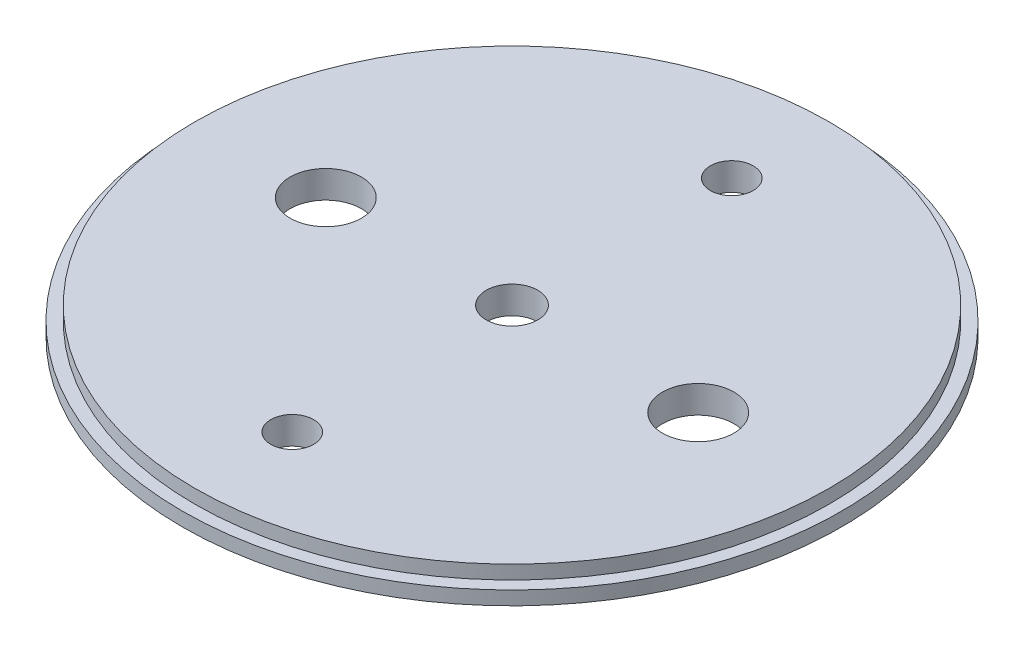
from build123d import *

# Parameters (mm, degrees)
SKETCH1_R           = 76.1746
BOSS_EXTRUDE1_DEPTH = 3.175
SKETCH1_3_R         = 73.3425
BOSS_EXTRUDE2_DEPTH = 6.35
SKETCH3_R           = 5.953125
SKETCH3_R_2         = 8.250047
SKETCH3_R_3         = 4.9609375
CUT_EXTRUDE1_DEPTH  = 108.914141197


with BuildPart() as part:
    # Sketch1 → Boss-Extrude1 (new body)
    with BuildSketch(Plane(origin=(0, 0, 0), x_dir=(1, 0, 0), z_dir=(0, 1, 0))):
        Circle(SKETCH1_R)
    extrude(amount=BOSS_EXTRUDE1_DEPTH)

    # Sketch1<3> → Boss-Extrude2 (add)
    with BuildSketch(Plane(origin=(0, 0, 0), x_dir=(1, 0, 0), z_dir=(0, 1, 0))):
        Circle(SKETCH1_3_R)
    extrude(amount=BOSS_EXTRUDE2_DEPTH)

    # Sketch3 → Cut-Extrude1 (cut, through all)
    with BuildSketch(Plane.XZ):
        Circle(SKETCH3_R)
        with Locations((-43.038165324, 0)):
            Circle(SKETCH3_R_2)
        with Locations((43.038165324, 0)):
            Circle(SKETCH3_R_2)
        with Locations((0, 50.8)):
            Circle(SKETCH3_R_3)
        with Locations((0, -50.8)):
            Circle(SKETCH3_R_3)
    extrude(amount=-CUT_EXTRUDE1_DEPTH, mode=Mode.SUBTRACT)


solid = part.part
